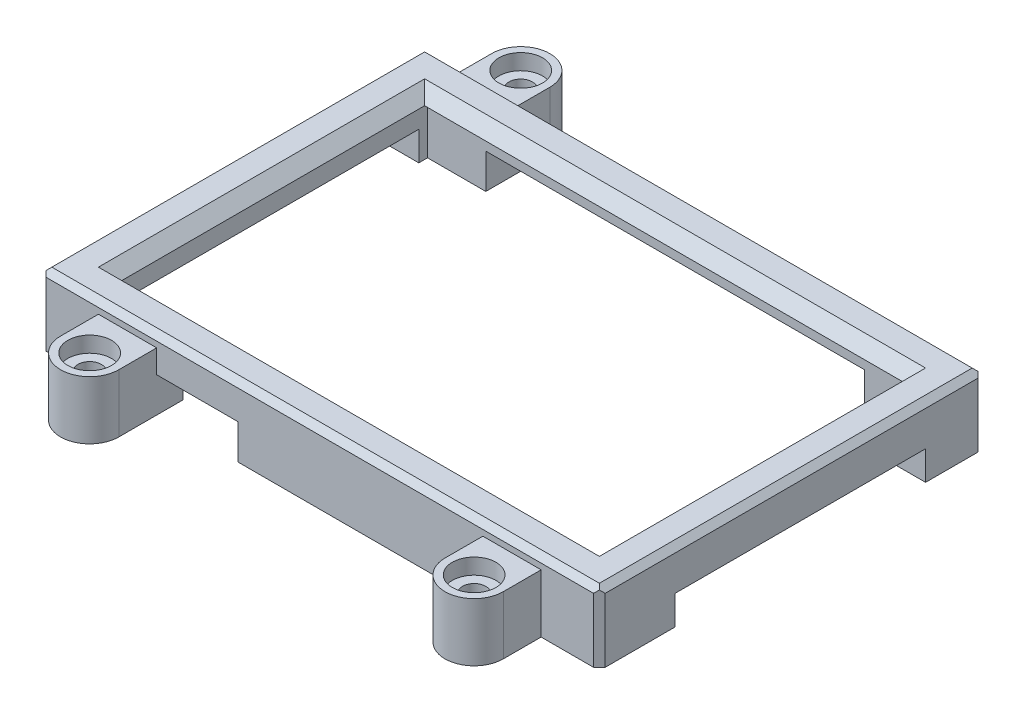
from build123d import *

# Parameters (mm, degrees)
SKETCH1_W           = 86
SKETCH1_H           = 57
BOSS_EXTRUDE1_DEPTH = 10
SKETCH2_R           = 2
CUT_EXTRUDE1_DEPTH  = 67.213669284
SKETCH4_W           = 96
SKETCH4_H           = 66
SKETCH4_W_2         = 82
SKETCH4_H_2         = 52
BOSS_EXTRUDE2_DEPTH = 2
SKETCH6_W           = 54
SKETCH6_H           = 5
CUT_EXTRUDE2_DEPTH  = 5
SKETCH7_W           = 43
SKETCH7_H           = 5
CUT_EXTRUDE3_DEPTH  = 5
CHAMFER1_SIZE       = 2
CHAMFER2_SIZE       = 1
CHAMFER3_SIZE       = 1
CHAMFER4_SIZE       = 1
SKETCH9_R           = 3.75
CUT_EXTRUDE4_DEPTH  = 2.7
SKETCH10_W          = 65
SKETCH10_H          = 6
CUT_EXTRUDE5_DEPTH  = 4.5
SKETCH11_W          = 14
SKETCH11_H          = 6
CUT_EXTRUDE6_DEPTH  = 4.5


with BuildPart() as part:
    # Sketch1 → Boss-Extrude1 (new body)
    with BuildSketch(Plane(origin=(0, 0, 0), x_dir=(1, 0, 0), z_dir=(0, 1, 0))):
        with BuildLine():
            Line((48, -33), (48, 33))
            Line((48, 33), (-33, 33))
            Line((-33, 33), (-33, 39.5))
            ThreePointArc((-33, 39.5), (-38, 44.5), (-43, 39.5))
            Line((-43, 39.5), (-43, 33))
            Line((-43, 33), (-48, 33))
            Line((-48, 33), (-48, -33))
            Line((-48, -33), (-38, -33))
            Line((-38, -33), (-38, -39.5))
            ThreePointArc((-38, -39.5), (-33, -44.5), (-28, -39.5))
            Line((-28, -39.5), (-28, -33))
            Line((-28, -33), (28, -33))
            Line((28, -33), (28, -39.5))
            ThreePointArc((28, -39.5), (33, -44.5), (38, -39.5))
            Line((38, -39.5), (38, -33))
            Line((38, -33), (48, -33))
        make_face()
        Rectangle(SKETCH1_W, SKETCH1_H, mode=Mode.SUBTRACT)
    extrude(amount=BOSS_EXTRUDE1_DEPTH)

    # Sketch2 → Cut-Extrude1 (cut, through all)
    with BuildSketch(Plane(origin=(0, 10, 0), x_dir=(1, 0, 0), z_dir=(0, 1, 0))):
        with Locations(Location((-38, 39.5, 0), (0, 0, 270))):
            Circle(SKETCH2_R)
        with Locations(Location((33, -39.5, 0), (0, 0, 270))):
            Circle(SKETCH2_R)
        with Locations(Location((-33, -39.5, 0), (0, 0, 270))):
            Circle(SKETCH2_R)
    extrude(amount=-CUT_EXTRUDE1_DEPTH, mode=Mode.SUBTRACT)

    # Sketch4 → Boss-Extrude2 (add)
    with BuildSketch(Plane(origin=(0, 10, 0), x_dir=(1, 0, 0), z_dir=(0, 1, 0))):
        Rectangle(SKETCH4_W, SKETCH4_H)
        Rectangle(SKETCH4_W_2, SKETCH4_H_2, mode=Mode.SUBTRACT)
    extrude(amount=BOSS_EXTRUDE2_DEPTH)

    # Sketch6 → Cut-Extrude2 (cut)
    with BuildSketch(Plane.ZY.offset(48)):
        with Locations((0, 2.5)):
            Rectangle(SKETCH6_W, SKETCH6_H)
    extrude(amount=-CUT_EXTRUDE2_DEPTH, mode=Mode.SUBTRACT)

    # Sketch7 → Cut-Extrude3 (cut)
    with BuildSketch(Plane(origin=(48, 0, 0), x_dir=(0, 0, -1), z_dir=(1, 0, 0))):
        with Locations((1.5, 2.5)):
            Rectangle(SKETCH7_W, SKETCH7_H)
    extrude(amount=-CUT_EXTRUDE3_DEPTH, mode=Mode.SUBTRACT)

    # Chamfer1
    chamfer1_edges = [part.edges().sort_by_distance(p)[0] for p in [
        (-41, 12, 0),
        (0, 12, 26),
        (41, 12, 0),
        (0, 12, -26),
    ]]
    chamfer(chamfer1_edges, length=CHAMFER1_SIZE - 0.0001)  # a hair under: the kernel refuses the full size

    # Chamfer2
    chamfer2_edges = [part.edges().sort_by_distance(p)[0] for p in [
        (-48, 12, 0),
        (0, 12, 33),
        (48, 12, 0),
        (0, 12, -33),
    ]]
    chamfer(chamfer2_edges, length=CHAMFER2_SIZE)

    # Chamfer3
    chamfer3_edges = [part.edges().sort_by_distance(p)[0] for p in [
        (-48, 5.5, -33),
    ]]
    chamfer(chamfer3_edges, length=CHAMFER3_SIZE)

    # Chamfer4
    chamfer4_edges = [part.edges().sort_by_distance(p)[0] for p in [
        (48, 5.5, 33),
        (-48, 5.5, 33),
        (48, 5.5, -33),
    ]]
    chamfer(chamfer4_edges, length=CHAMFER4_SIZE)

    # Sketch9 → Cut-Extrude4 (cut)
    with BuildSketch(Plane(origin=(0, 10, 0), x_dir=(1, 0, 0), z_dir=(0, 1, 0))):
        with Locations(Location((-38, 39.5, 0), (0, 0, 270))):
            Circle(SKETCH9_R)
        with Locations(Location((-33, -39.5, 0), (0, 0, 270))):
            Circle(SKETCH9_R)
        with Locations(Location((33, -39.5, 0), (0, 0, 270))):
            Circle(SKETCH9_R)
    extrude(amount=-CUT_EXTRUDE4_DEPTH, mode=Mode.SUBTRACT)

    # Sketch10 → Cut-Extrude5 (cut)
    with BuildSketch(Plane(origin=(0, 0, -33), x_dir=(-1, 0, 0), z_dir=(0, 0, -1))):
        with Locations((0.5, 3)):
            Rectangle(SKETCH10_W, SKETCH10_H)
    extrude(amount=-CUT_EXTRUDE5_DEPTH, mode=Mode.SUBTRACT)

    # Sketch11 → Cut-Extrude6 (cut)
    with BuildSketch(Plane.XY.offset(33)):
        with Locations((-21, 3)):
            Rectangle(SKETCH11_W, SKETCH11_H)
    extrude(amount=-CUT_EXTRUDE6_DEPTH, mode=Mode.SUBTRACT)


solid = part.part
